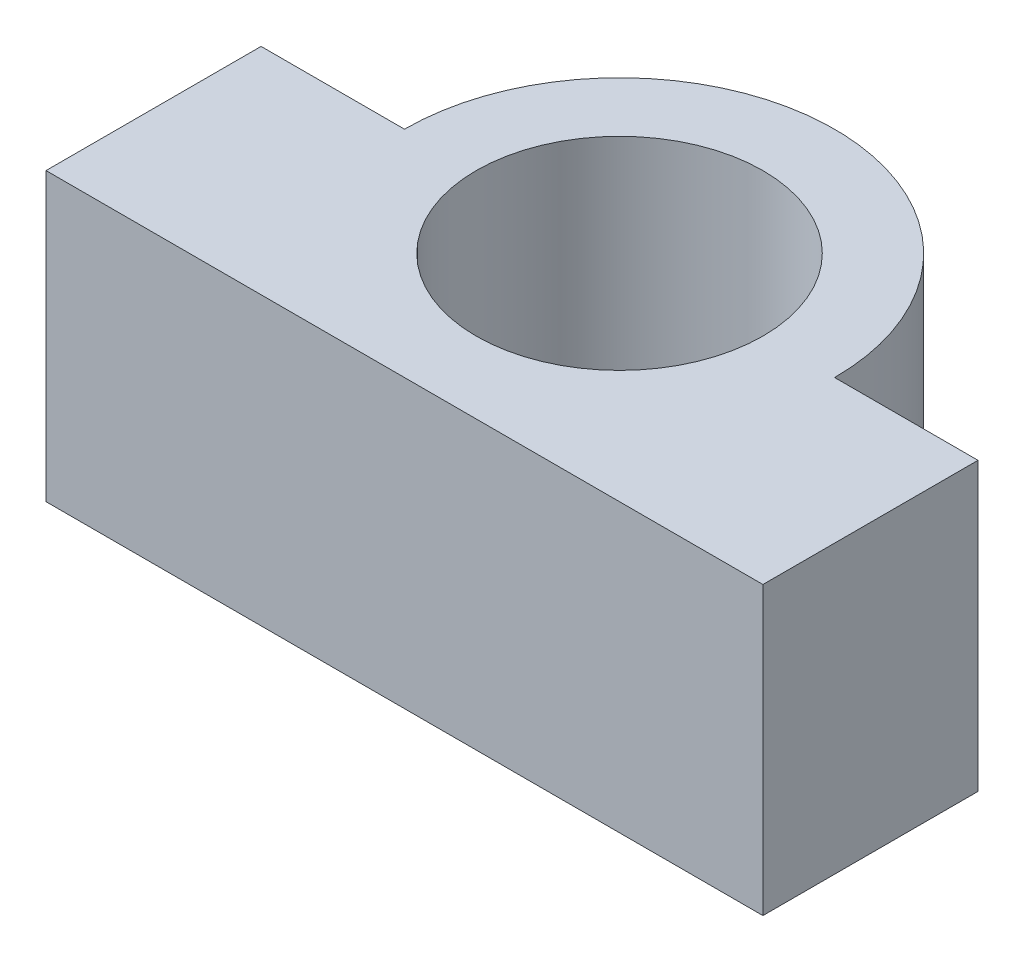
from build123d import *

# Parameters (mm, degrees)
BOSS_EXTRUDE1_DEPTH = 20
SKETCH3_R           = 10
CUT_EXTRUDE1_DEPTH  = 62.64414003


with BuildPart() as part:
    # Sketch2 → Boss-Extrude1 (new body)
    with BuildSketch(Plane(origin=(0, 0, 0), x_dir=(1, 0, 0), z_dir=(0, 1, 0))):
        with BuildLine():
            Line((-50, 0), (0, 0))
            Line((0, 0), (0, 15))
            Line((0, 15), (-10, 15))
            ThreePointArc((-10, 15), (-25, 30), (-40, 15))
            Line((-40, 15), (-50, 15))
            Line((-50, 15), (-50, 0))
        make_face()
    extrude(amount=BOSS_EXTRUDE1_DEPTH)

    # Sketch3 → Cut-Extrude1 (cut, through all)
    with BuildSketch(Plane(origin=(0, 0, 0), x_dir=(-1, 0, 0), z_dir=(0, -1, 0))):
        with Locations((25, 15)):
            Circle(SKETCH3_R)
    extrude(amount=-CUT_EXTRUDE1_DEPTH, mode=Mode.SUBTRACT)


solid = part.part
